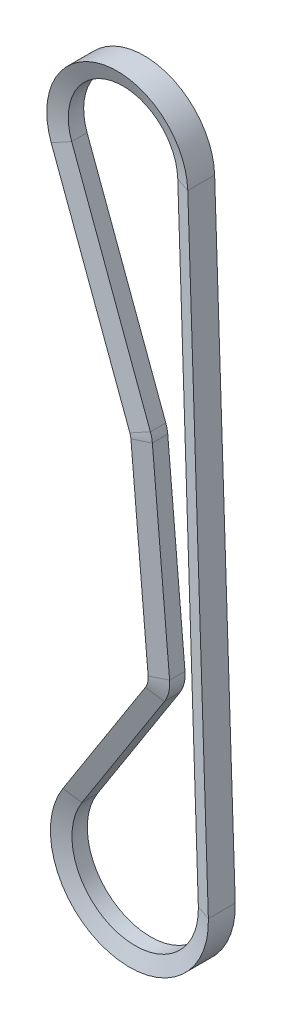
from build123d import *


with BuildPart() as part:
    # Sweep1: sweep along a path in Sketch2
    with BuildLine(Plane.XY) as sweep1_path:
        Line((24.986247493, 0.829117744), (32.281805243, -219.029415947))
        ThreePointArc((32.281805243, -219.029415947), (-3.124151892, -246.956609573), (-19.28086254, -204.855889323))
        Line((-19.28086254, -204.855889323), (9.960195608, -159.203564438))
        ThreePointArc((9.960195608, -159.203564438), (10.779286667, -157.295101153), (10.938796612, -155.224425212))
        Line((10.938796612, -155.224425212), (4.829615962, -85.49152113))
        ThreePointArc((4.829615962, -85.49152113), (4.698802578, -84.651076625), (4.456840376, -83.835654404))
        Line((4.456840376, -83.835654404), (-23.436988182, -8.701010571))
        ThreePointArc((-23.436988182, -8.701010571), (-4.827617169, 24.529453978), (24.986247493, 0.829117744))
    # Sketch3 → Sweep1 (sweep)
    with BuildSketch(Plane(origin=(-23.436988182, -8.701010571, 0), x_dir=(0.9374795272768498, 0.348040422848804, 0), z_dir=(-0.348040422848804, 0.9374795272768498, 0))):
        Polygon((0, -4.7625), (0, 4.7625), (5.588, 2.728634331), (5.588, -2.728634331), align=None)
    sweep(path=sweep1_path.line)


solid = part.part
